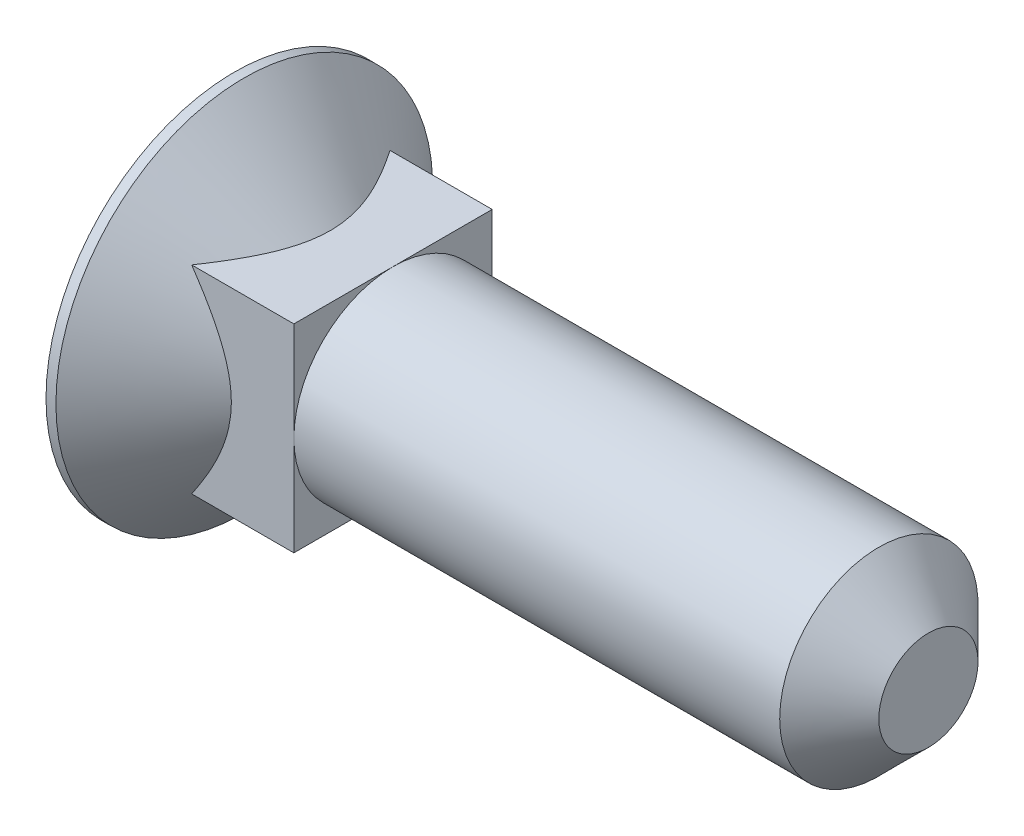
from build123d import *

# Parameters (mm, degrees)
SQUARESKE_W  = 10
SQUARESKE_H  = 10
SQUARE_DEPTH = 8


with BuildPart() as part:
    # BodySke → BaseBody (revolve)
    with BuildSketch(Plane.XY):
        Polygon((0, 0), (0, 9.5), (0.5, 9.5), (4.845599487, 5), (32.5, 5), (35, 2.5), (35, 0), align=None)
    revolve(axis=Axis((0, 0, 0), (1, 0, 0)))

    # SquareSke → Square (add)
    with BuildSketch(Plane(origin=(0, 0, 0), x_dir=(0, 0, -1), z_dir=(1, 0, 0))):
        Rectangle(SQUARESKE_W, SQUARESKE_H)
    extrude(amount=SQUARE_DEPTH)


solid = part.part
